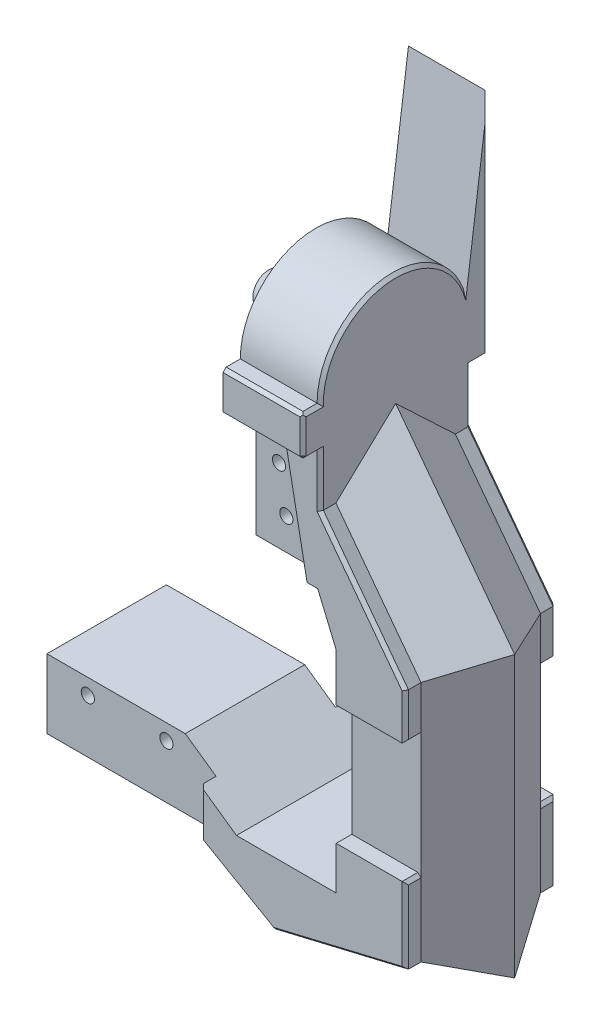
from build123d import *

# Parameters (mm, degrees)
SKETCH_1_R          = 2.1
EXTRUDE_1_DEPTH     = 38
CUT_EXTRUDE_1_DEPTH = 187.709206858
SKETCH_3_R          = 3
CUT_EXTRUDE_3_DEPTH = 1
EXTRUDE_2_DEPTH     = 5
EXTRUDE_3_DEPTH     = 5
EXTRUDE_2_2_DEPTH   = 25.432180104
EXTRUDE_7_DEPTH     = 25.432180104
SKETCH_18_W         = 25.432180104
SKETCH_18_H         = 5.5
EXTRUDE_8_DEPTH     = 2.30961622
EXTRUDE_10_DEPTH    = 5.5
SKETCH_21_R         = 5
SKETCH_20_R         = 13
CUT_EXTRUDE_4_REACH = 220.784
SKETCH_23_R         = 3
CHAMFER_1_SIZE      = 1


with BuildPart() as part:
    # 草图1 → 凸台-拉伸1 (new body)
    with BuildSketch(Plane.XY):
        Polygon((0, 0), (53.8, 0), (77, -13.394526245), (119, -3.414420564), (119, 73.585579436), (91.936542927, 109.5), (91.936542927, 158), (66.504362823, 158), (66.504362823, 88), (91.154362823, 88), (97, 74.085579436), (97, 7.085579436), (65.3, 7.085579436), (44, 22), (0, 22), align=None)
        with Locations((73.824362823, 111.53)):
            Circle(SKETCH_1_R, mode=Mode.SUBTRACT)
        with Locations((76.154362823, 98.03)):
            Circle(SKETCH_1_R, mode=Mode.SUBTRACT)
        with Locations((13, 17)):
            Circle(SKETCH_1_R, mode=Mode.SUBTRACT)
        with Locations((38, 17)):
            Circle(SKETCH_1_R, mode=Mode.SUBTRACT)
    extrude(amount=EXTRUDE_1_DEPTH)

    # 草图2 → 切除-拉伸1 (cut, through all)
    with BuildSketch(Plane(origin=(91.936542927, 0, 0), x_dir=(0, 0, -1), z_dir=(1, 0, 0))):
        with BuildLine():
            Line((-38, 158), (-38, 139))
            ThreePointArc((-38, 139), (-32.435028843, 152.435028843), (-19, 158))
            Line((-19, 158), (-38, 158))
        make_face()
        with BuildLine():
            Line((0, 158), (-19, 158))
            ThreePointArc((-19, 158), (-5.564971157, 152.435028843), (0, 139))
            Line((0, 139), (0, 158))
        make_face()
    extrude(amount=-CUT_EXTRUDE_1_DEPTH, mode=Mode.SUBTRACT)

    # 草图3 → 切除-拉伸3 (cut)
    with BuildSketch(Plane.ZY.offset(-66.504362823)):
        with Locations(Location((19, 139, 0), (0, 0, 270))):
            Circle(SKETCH_3_R)
    extrude(amount=-CUT_EXTRUDE_3_DEPTH, mode=Mode.SUBTRACT)

    # 扫描3: sweep along a path in 草图13
    with BuildLine(Plane.XY.offset(19)) as sweep_3_path:
        Line((91.936542927, 127.429097123), (129.79, 77.195862934))
        Line((129.79, 77.195862934), (129.79, -11.941020396))
        Line((129.79, -11.941020396), (77, -24.485062752))
    # 草图4 → 扫描3 (sweep)
    with BuildSketch(Plane.ZY.offset(-77)):
        Polygon((38, -13.394526245), (0, -13.394526245), (19, -24.485062752), align=None)
    sweep(path=sweep_3_path.line, transition=Transition.RIGHT)

    # 草图14 → Extrude 2 (add)
    with BuildSketch(Plane.XY.offset(38)):
        Polygon((66.504362823, 139), (66.504362823, 126.148557267), (80.434084519, 126.148557267), (87.742437222, 88), (91.154362823, 88), (97, 74.085579436), (97, 58.870893274), (118.999906629, 58.870893274), (118.999906629, 73.585548195), (91.936542927, 109.499844851), (91.936542927, 139), align=None)
        Polygon((118.999906629, 20.768869661), (97, 20.768869661), (97, 7.085579436), (65.3, 7.085579436), (53.8, 15.137966126), (53.8, 0), (77, -13.394526245), (118.999906629, -3.414439978), align=None)
    extrude(amount=EXTRUDE_2_DEPTH)

    # 草图15 → 凸台-拉伸3 (add)
    with BuildSketch(Plane(origin=(0, 0, 0), x_dir=(-1, 0, 0), z_dir=(0, 0, -1))):
        Polygon((-118.999906629, 73.585548195), (-118.999906629, 58.870893274), (-97, 58.870893274), (-97, 74.085579436), (-91.154362823, 88), (-87.742437222, 88), (-80.434084519, 126.148557267), (-66.504362823, 126.148557267), (-66.504362823, 139), (-91.936542927, 139), (-91.936542927, 109.499844851), align=None)
        Polygon((-77, -13.394526245), (-53.8, 0), (-53.8, 15.137966126), (-65.3, 7.085579436), (-97, 7.085579436), (-97, 20.768869661), (-118.999906629, 20.768869661), (-118.999906629, -3.414442751), align=None)
    extrude(amount=EXTRUDE_3_DEPTH)

    # 草图16 → Extrude 2 2 (add)
    with BuildSketch(Plane(origin=(91.936542927, 0, 0), x_dir=(0, 0, -1), z_dir=(1, 0, 0))):
        with BuildLine():
            ThreePointArc((-43, 139), (-19, 163), (5, 139))
            Line((5, 139), (-5, 139))
            ThreePointArc((-5, 139), (-19, 153), (-33, 139))
            Line((-33, 139), (-43, 139))
        make_face()
    extrude(amount=-EXTRUDE_2_2_DEPTH)

    # 草图17 → 凸台-拉伸7 (add)
    with BuildSketch(Plane(origin=(91.936542927, 0, 0), x_dir=(0, 0, -1), z_dir=(1, 0, 0))):
        with BuildLine():
            Line((5, 139), (5, 128.458173487))
            Line((5, 128.458173487), (10.5, 128.458173487))
            Line((10.5, 128.458173487), (10.5, 198.458173487))
            Line((10.5, 198.458173487), (3.602302269, 147.070683498))
            ThreePointArc((3.602302269, 147.070683498), (4.647994148, 143.095408742), (5, 139))
        make_face()
    extrude(amount=-EXTRUDE_7_DEPTH)

    # 草图18 → 凸台-拉伸8 (add)
    with BuildSketch(Plane.XZ.offset(-128.458173487)):
        with Locations((79.220452875, -7.75)):
            Rectangle(SKETCH_18_W, SKETCH_18_H)
    extrude(amount=EXTRUDE_8_DEPTH)

    # 草图19 → 凸台-拉伸10 (add)
    with BuildSketch(Plane.XY.offset(43)):
        Polygon((66.504362823, 126.148557267), (80.434084519, 126.148557267), (91.936542927, 126.148557267), (91.936542927, 139), (66.504362823, 139), align=None)
    extrude(amount=EXTRUDE_10_DEPTH)

    # 草图21 → 放样1 section 0
    with BuildSketch(Plane.ZY.offset(-51.504362823)):
        with Locations((19, 139)):
            Circle(SKETCH_21_R)
    # 草图20 → 放样1 section 1
    with BuildSketch(Plane.ZY.offset(-66.504362823)):
        with Locations((19, 139)):
            Circle(SKETCH_20_R)
    loft()

    # 草图23 → 切除-拉伸4 (cut, up to next)
    with BuildSketch(Plane.ZY.offset(-51.504362823), mode=Mode.PRIVATE) as cut_extrude_4_sk1:
        with Locations(Location((19, 139, 0), (0, 0, 270))):
            Circle(SKETCH_23_R)
    cut_extrude_4_tool1 = extrude(cut_extrude_4_sk1.sketch, amount=-CUT_EXTRUDE_4_REACH, mode=Mode.PRIVATE) & part.part
    add(cut_extrude_4_tool1.solids().sort_by_distance((51.504363, 139, 19))[0], mode=Mode.SUBTRACT)

    # 倒角1
    chamfer_1_edges = [part.edges().sort_by_distance(p)[0] for p in [
        (79.220452875, 139, 48.5),
    ]]
    chamfer(chamfer_1_edges, length=CHAMFER_1_SIZE)

    # 倒角3
    # the kernel refuses this chamfer: 1 mm, written as the material it takes off along each edge
    with BuildSketch(Plane(origin=(91.26987626, 126.815223933, 47.833333333), x_dir=(-0.7071067811865475, 0, 0.7071067811865475), z_dir=(0.5773502691896258, -0.5773502691896258, 0.5773502691896258))) as chamfer_3_piece_1:
        Polygon((-0.707106781, -0.40824829), (0.707106781, -0.40824829), (0, 0.816496581), align=None)
    extrude(amount=1.270170592, mode=Mode.SUBTRACT)
    with BuildSketch(Plane(origin=(53.8, 17.709649114, 43), x_dir=(0.9996219169112968, 0, 0.027495876610589005), z_dir=(0, -1, 0)), Plane(origin=(53.8, -2.571682988, -5), x_dir=(0.9996219169112968, 0, -0.027495876610586414), z_dir=(0, 1, 0))) as chamfer_3_piece_2:
        with BuildLine():
            Line((1.028673195, 0), (-0.056547155, -1.027117794))
            Line((-0.056547155, -1.027117794), (-0.076539593, -1.026567876))
            ThreePointArc((-0.076539593, -1.026567876), (-0.034129227, -0.51339783), (-0.019992438, 0.000549918))
            Line((-0.019992438, 0.000549918), (0.000549918, 0.019992438))
            ThreePointArc((0.000549918, 0.019992438), (0.514497665, 0.00585565), (1.029223113, 0.019992438))
            Line((1.029223113, 0.019992438), (1.028673195, 0))
        make_face()
    extrude(amount=20.281332101, mode=Mode.SUBTRACT)
    with BuildSketch(Plane(origin=(118.999906629, 20.768869661, 38), x_dir=(-0.9996219169112968, 0.02749587661058574, 0), z_dir=(0, 0, 1)), Plane(origin=(118.999906629, 58.870893274, 38), x_dir=(0.027495876610582105, 0.999621916911297, 0), z_dir=(0, 0, 1)), Plane(origin=(118.999906629, 58.870893274, 0), x_dir=(-0.9996219169112968, -0.027495876610589196, 0), z_dir=(0, 0, -1))) as chamfer_3_piece_3:
        with BuildLine():
            Line((1.028673195, 0), (-0.056547155, 1.027117794))
            Line((-0.056547155, 1.027117794), (-0.076539593, 1.026567876))
            ThreePointArc((-0.076539593, 1.026567876), (-0.034129227, 0.51339783), (-0.019992438, -0.000549918))
            Line((-0.019992438, -0.000549918), (0.000549918, -0.019992438))
            ThreePointArc((0.000549918, -0.019992438), (0.514497665, -0.00585565), (1.029223113, -0.019992438))
            Line((1.029223113, -0.019992438), (1.028673195, 0))
        make_face()
    extrude(amount=7.571682988, mode=Mode.SUBTRACT)
    with BuildSketch(Plane(origin=(51.572857202, 1.285841494, 43), x_dir=(0.4998109584556499, 0.8656979742248793, 0.027495876610589116), z_dir=(0.8660254037844378, -0.5000000000000017, 0)), Plane(origin=(79.227142798, -14.680367739, -5), x_dir=(0.49981095845565, 0.8656979742248795, -0.027495876610586535), z_dir=(-0.8660254037844378, 0.5000000000000017, 0))) as chamfer_3_piece_4:
        with BuildLine():
            Line((1.028673195, 0), (-0.056547155, -1.027117794))
            Line((-0.056547155, -1.027117794), (-0.076539593, -1.026567876))
            ThreePointArc((-0.076539593, -1.026567876), (-0.034129227, -0.51339783), (-0.019992438, 0.000549918))
            Line((-0.019992438, 0.000549918), (0.000549918, 0.019992438))
            ThreePointArc((0.000549918, 0.019992438), (0.514497665, 0.00585565), (1.029223113, 0.019992438))
            Line((1.029223113, 0.019992438), (1.028673195, 0))
        make_face()
    extrude(amount=31.932418466, mode=Mode.SUBTRACT)
    with BuildSketch(Plane(origin=(74.497984058, -13.989059351, 43), x_dir=(0.006356618994580412, -0.0267510116732474, -0.9996219169112968), z_dir=(0.9729099403562855, 0.23118444574825722, 0))) as chamfer_3_piece_5:
        with BuildLine():
            Line((1.028673195, 0), (-0.056547155, 1.027117794))
            Line((-0.056547155, 1.027117794), (-0.076539593, 1.026567876))
            ThreePointArc((-0.076539593, 1.026567876), (-0.034129227, 0.51339783), (-0.019992438, -0.000549918))
            Line((-0.019992438, -0.000549918), (0.000549918, -0.019992438))
            ThreePointArc((0.000549918, -0.019992438), (0.514497665, -0.00585565), (1.029223113, -0.019992438))
            Line((1.029223113, -0.019992438), (1.028673195, 0))
        make_face()
    extrude(amount=48.312733341, mode=Mode.SUBTRACT)
    with BuildSketch(Plane(origin=(118.999906629, -5.986122965, 43), x_dir=(0.027495876610582105, 0, -0.999621916911297), z_dir=(0, 1, 0))) as chamfer_3_piece_6:
        with BuildLine():
            Line((1.028673195, 0), (-0.056547155, 1.027117794))
            Line((-0.056547155, 1.027117794), (-0.076539593, 1.026567876))
            ThreePointArc((-0.076539593, 1.026567876), (-0.034129227, 0.51339783), (-0.019992438, -0.000549918))
            Line((-0.019992438, -0.000549918), (0.000549918, -0.019992438))
            ThreePointArc((0.000549918, -0.019992438), (0.514497665, -0.00585565), (1.029223113, -0.019992438))
            Line((1.029223113, -0.019992438), (1.028673195, 0))
        make_face()
    extrude(amount=29.326675615, mode=Mode.SUBTRACT)
    with BuildSketch(Plane(origin=(118.999906629, 56.299210286, 43), x_dir=(-0.9996219169112968, 0, 0.027495876610589196), z_dir=(0, 1, 0)), Plane(origin=(118.999906629, 76.157231183, -5), x_dir=(-0.9996219169112968, 0, -0.027495876610586605), z_dir=(0, -1, 0))) as chamfer_3_piece_7:
        with BuildLine():
            Line((1.028673195, 0), (-0.056547155, -1.027117794))
            Line((-0.056547155, -1.027117794), (-0.076539593, -1.026567876))
            ThreePointArc((-0.076539593, -1.026567876), (-0.034129227, -0.51339783), (-0.019992438, 0.000549918))
            Line((-0.019992438, 0.000549918), (0.000549918, 0.019992438))
            ThreePointArc((0.000549918, 0.019992438), (0.514497665, 0.00585565), (1.029223113, 0.019992438))
            Line((1.029223113, 0.019992438), (1.028673195, 0))
        make_face()
    extrude(amount=19.858020896, mode=Mode.SUBTRACT)
    with BuildSketch(Plane(origin=(120.547584086, 71.53171084, 43), x_dir=(-0.7983335594669047, -0.6015874870692686, 0.027495876610589096), z_dir=(-0.60181502315205, 0.7986355100472916, 0))) as chamfer_3_piece_8_section:
        with BuildLine():
            Line((1.028673195, 0), (-0.056547155, -1.027117794))
            Line((-0.056547155, -1.027117794), (-0.076539593, -1.026567876))
            ThreePointArc((-0.076539593, -1.026567876), (-0.034129227, -0.51339783), (-0.019992438, 0.000549918))
            Line((-0.019992438, 0.000549918), (0.000549918, 0.019992438))
            ThreePointArc((0.000549918, 0.019992438), (0.514497665, 0.00585565), (1.029223113, 0.019992438))
            Line((1.029223113, 0.019992438), (1.028673195, 0))
        make_face()
    chamfer_3_piece_8 = extrude(amount=50.112937457, mode=Mode.PRIVATE)
    chamfer_3_piece_8 = split(chamfer_3_piece_8, bisect_by=Plane(origin=(91.936542927, 90.144566019, 42.669249939), z_dir=(1, 0, 0)), keep=Keep.TOP, mode=Mode.PRIVATE)
    add(chamfer_3_piece_8, mode=Mode.SUBTRACT)
    with BuildSketch(Plane(origin=(91.936542927, 106.928161863, 43), x_dir=(0.027495876610582105, 0, -0.999621916911297), z_dir=(0, 1, 0))) as chamfer_3_piece_9_section:
        with BuildLine():
            Line((1.028673195, 0), (-0.056547155, 1.027117794))
            Line((-0.056547155, 1.027117794), (-0.076539593, 1.026567876))
            ThreePointArc((-0.076539593, 1.026567876), (-0.034129227, 0.51339783), (-0.019992438, -0.000549918))
            Line((-0.019992438, -0.000549918), (0.000549918, -0.019992438))
            ThreePointArc((0.000549918, -0.019992438), (0.514497665, -0.00585565), (1.029223113, -0.019992438))
            Line((1.029223113, -0.019992438), (1.028673195, 0))
        make_face()
    chamfer_3_piece_9 = extrude(amount=19.220395404, mode=Mode.PRIVATE)
    chamfer_3_piece_9 = split(chamfer_3_piece_9, bisect_by=Plane(origin=(87.71452173, 115.102656217, 42.667427315), z_dir=(0.7986355100472916, 0.60181502315205, 0)), keep=Keep.TOP, mode=Mode.PRIVATE)
    add(chamfer_3_piece_9, mode=Mode.SUBTRACT)
    with BuildSketch(Plane(origin=(90.38886547, 111.553682205, -5), x_dir=(-0.7983335594669051, -0.6015874870692681, -0.027495876610586504), z_dir=(0.6018150231520495, -0.7986355100472919, 0))) as chamfer_3_piece_10_section:
        with BuildLine():
            Line((1.028673195, 0), (-0.056547155, -1.027117794))
            Line((-0.056547155, -1.027117794), (-0.076539593, -1.026567876))
            ThreePointArc((-0.076539593, -1.026567876), (-0.034129227, -0.51339783), (-0.019992438, 0.000549918))
            Line((-0.019992438, 0.000549918), (0.000549918, 0.019992438))
            ThreePointArc((0.000549918, 0.019992438), (0.514497665, 0.00585565), (1.029223113, 0.019992438))
            Line((1.029223113, 0.019992438), (1.028673195, 0))
        make_face()
    chamfer_3_piece_10 = extrude(amount=50.112937457, mode=Mode.PRIVATE)
    chamfer_3_piece_10 = split(chamfer_3_piece_10, bisect_by=Plane(origin=(91.936542927, 90.144566019, -4.669249939), z_dir=(1, 0, 0)), keep=Keep.TOP, mode=Mode.PRIVATE)
    add(chamfer_3_piece_10, mode=Mode.SUBTRACT)
    with BuildSketch(Plane(origin=(118.999906629, 20.768869661, 0), x_dir=(-0.9996219169112968, 0.02749587661058574, 0), z_dir=(0, 0, -1))) as chamfer_3_piece_11:
        with BuildLine():
            Line((1.028673195, 0), (-0.056547155, -1.027117794))
            Line((-0.056547155, -1.027117794), (-0.076539593, -1.026567876))
            ThreePointArc((-0.076539593, -1.026567876), (-0.034129227, -0.51339783), (-0.019992438, 0.000549918))
            Line((-0.019992438, 0.000549918), (0.000549918, 0.019992438))
            ThreePointArc((0.000549918, 0.019992438), (0.514497665, 0.00585565), (1.029223113, 0.019992438))
            Line((1.029223113, 0.019992438), (1.028673195, 0))
        make_face()
    extrude(amount=7.571682988, mode=Mode.SUBTRACT)
    with BuildSketch(Plane(origin=(118.999906629, 23.340552649, -5), x_dir=(0.02749587661058217, 0, 0.9996219169112968), z_dir=(0, -1, 0))) as chamfer_3_piece_12:
        with BuildLine():
            Line((1.028673195, 0), (-0.056547155, 1.027117794))
            Line((-0.056547155, 1.027117794), (-0.076539593, 1.026567876))
            ThreePointArc((-0.076539593, 1.026567876), (-0.034129227, 0.51339783), (-0.019992438, -0.000549918))
            Line((-0.019992438, -0.000549918), (0.000549918, -0.019992438))
            ThreePointArc((0.000549918, -0.019992438), (0.514497665, -0.00585565), (1.029223113, -0.019992438))
            Line((1.029223113, -0.019992438), (1.028673195, 0))
        make_face()
    extrude(amount=29.326678388, mode=Mode.SUBTRACT)
    with BuildSketch(Plane(origin=(121.501922608, -2.819909801, -5), x_dir=(-0.2310969780314448, 0.9725421140054292, -0.027495876610586514), z_dir=(-0.9729099548061726, -0.231184384937762, 0))) as chamfer_3_piece_13:
        with BuildLine():
            Line((1.028673195, 0), (-0.056547155, -1.027117794))
            Line((-0.056547155, -1.027117794), (-0.076539593, -1.026567876))
            ThreePointArc((-0.076539593, -1.026567876), (-0.034129227, -0.51339783), (-0.019992438, 0.000549918))
            Line((-0.019992438, 0.000549918), (0.000549918, 0.019992438))
            ThreePointArc((0.000549918, 0.019992438), (0.514497665, 0.00585565), (1.029223113, 0.019992438))
            Line((1.029223113, 0.019992438), (1.028673195, 0))
        make_face()
    extrude(amount=48.3127327, mode=Mode.SUBTRACT)
    with BuildSketch(Plane(origin=(91.936542927, 139, 19), x_dir=(0, 0, 1), z_dir=(0, -1, 0))) as chamfer_3_piece_14_section:
        with BuildLine():
            Line((22.971715729, -0.028284271), (24.028284271, 1.028284271))
            Line((24.028284271, 1.028284271), (24.048284271, 1.028284271))
            ThreePointArc((24.048284271, 1.028284271), (24.02, 0.514142136), (24.02, 0))
            Line((24.02, 0), (24, -0.02))
            ThreePointArc((24, -0.02), (23.485857864, -0.02), (22.971715729, -0.048284271))
            Line((22.971715729, -0.048284271), (22.971715729, -0.028284271))
        make_face()
    chamfer_3_piece_14 = revolve(axis=Axis((91.936542927, 139, 19), (-1, 0, 0)), revolution_arc=166.496974045, mode=Mode.PRIVATE)
    chamfer_3_piece_14 = split(chamfer_3_piece_14, bisect_by=Plane(origin=(91.460066415, 158.711193826, -5.164797766), z_dir=(0, 0.13303598850024104, 0.9911112075664182)), keep=Keep.TOP, mode=Mode.PRIVATE)
    add(chamfer_3_piece_14, mode=Mode.SUBTRACT)
    with BuildSketch(Plane(origin=(91.936542927, 123.576874279, -10.5), x_dir=(0.0274958766105822, 0, 0.999621916911297), z_dir=(0, 1, 0))) as chamfer_3_piece_15:
        with BuildLine():
            Line((1.028673195, 0), (-0.056547155, -1.027117794))
            Line((-0.056547155, -1.027117794), (-0.076539593, -1.026567876))
            ThreePointArc((-0.076539593, -1.026567876), (-0.034129227, -0.51339783), (-0.019992438, 0.000549918))
            Line((-0.019992438, 0.000549918), (0.000549918, 0.019992438))
            ThreePointArc((0.000549918, 0.019992438), (0.514497665, 0.00585565), (1.029223113, 0.019992438))
            Line((1.029223113, 0.019992438), (1.028673195, 0))
        make_face()
    extrude(amount=77.452982196, mode=Mode.SUBTRACT)
    with BuildSketch(Plane(origin=(91.936542927, 126.148557267, -5), x_dir=(0.02749587661058217, 0, 0.9996219169112968), z_dir=(0, -1, 0))) as chamfer_3_piece_16_section:
        with BuildLine():
            Line((1.028673195, 0), (-0.056547155, 1.027117794))
            Line((-0.056547155, 1.027117794), (-0.076539593, 1.026567876))
            ThreePointArc((-0.076539593, 1.026567876), (-0.034129227, 0.51339783), (-0.019992438, -0.000549918))
            Line((-0.019992438, -0.000549918), (0.000549918, -0.019992438))
            ThreePointArc((0.000549918, -0.019992438), (0.514497665, -0.00585565), (1.029223113, -0.019992438))
            Line((1.029223113, -0.019992438), (1.028673195, 0))
        make_face()
    chamfer_3_piece_16 = extrude(amount=19.220395404, mode=Mode.PRIVATE)
    chamfer_3_piece_16 = split(chamfer_3_piece_16, bisect_by=Plane(origin=(87.71452173, 115.102656217, -4.667427315), z_dir=(0.7986355100472919, 0.6018150231520495, 0)), keep=Keep.TOP, mode=Mode.PRIVATE)
    add(chamfer_3_piece_16, mode=Mode.SUBTRACT)
    with BuildSketch(Plane(origin=(91.936542927, 126.148557267, -13.071682988), x_dir=(0.02749587661058229, 0.9996219169112968, 0), z_dir=(0, 0, 1)), Plane(origin=(91.936542927, 126.148557267, 43), x_dir=(0.02749587661058229, 0.9996219169112968, 0), z_dir=(0, 0, 1))) as chamfer_3_piece_17:
        with BuildLine():
            Line((1.028673195, 0), (-0.056547155, 1.027117794))
            Line((-0.056547155, 1.027117794), (-0.076539593, 1.026567876))
            ThreePointArc((-0.076539593, 1.026567876), (-0.034129227, 0.51339783), (-0.019992438, -0.000549918))
            Line((-0.019992438, -0.000549918), (0.000549918, -0.019992438))
            ThreePointArc((0.000549918, -0.019992438), (0.514497665, -0.00585565), (1.029223113, -0.019992438))
            Line((1.029223113, -0.019992438), (1.028673195, 0))
        make_face()
    extrude(amount=8.071682988, mode=Mode.SUBTRACT)
    with BuildSketch(Plane(origin=(94.508225915, 126.148557267, 48.5), x_dir=(0, 0.9996219169112968, 0.027495876610589196), z_dir=(-1, 0, 0))) as chamfer_3_piece_18:
        with BuildLine():
            Line((1.028673195, 0), (-0.056547155, 1.027117794))
            Line((-0.056547155, 1.027117794), (-0.076539593, 1.026567876))
            ThreePointArc((-0.076539593, 1.026567876), (-0.034129227, 0.51339783), (-0.019992438, -0.000549918))
            Line((-0.019992438, -0.000549918), (0.000549918, -0.019992438))
            ThreePointArc((0.000549918, -0.019992438), (0.514497665, -0.00585565), (1.029223113, -0.019992438))
            Line((1.029223113, -0.019992438), (1.028673195, 0))
        make_face()
    extrude(amount=30.575546079, mode=Mode.SUBTRACT)
    with BuildSketch(Plane(origin=(91.936542927, 123.576874279, 48.5), x_dir=(0.027495876610582105, 0, -0.999621916911297), z_dir=(0, 1, 0))) as chamfer_3_piece_19:
        with BuildLine():
            Line((1.028673195, 0), (-0.056547155, 1.027117794))
            Line((-0.056547155, 1.027117794), (-0.076539593, 1.026567876))
            ThreePointArc((-0.076539593, 1.026567876), (-0.034129227, 0.51339783), (-0.019992438, -0.000549918))
            Line((-0.019992438, -0.000549918), (0.000549918, -0.019992438))
            ThreePointArc((0.000549918, -0.019992438), (0.514497665, -0.00585565), (1.029223113, -0.019992438))
            Line((1.029223113, -0.019992438), (1.028673195, 0))
        make_face()
    extrude(amount=16.994808709, mode=Mode.SUBTRACT)
    with BuildSketch(Plane(origin=(91.936542927, 139, 40.428317012), x_dir=(-0.999621916911297, 0.027495876610582292, 0), z_dir=(0, 0, 1))) as chamfer_3_piece_20_section:
        with BuildLine():
            Line((1.028673195, 0), (-0.056547155, 1.027117794))
            Line((-0.056547155, 1.027117794), (-0.076539593, 1.026567876))
            ThreePointArc((-0.076539593, 1.026567876), (-0.034129227, 0.51339783), (-0.019992438, -0.000549918))
            Line((-0.019992438, -0.000549918), (0.000549918, -0.019992438))
            ThreePointArc((0.000549918, -0.019992438), (0.514497665, -0.00585565), (1.029223113, -0.019992438))
            Line((1.029223113, -0.019992438), (1.028673195, 0))
        make_face()
    chamfer_3_piece_20 = extrude(amount=9.643365976, mode=Mode.PRIVATE)
    chamfer_3_piece_20 = chamfer_3_piece_20 - Plane(origin=(91.606828487, 139, 19), x_dir=(0, 0, 1), z_dir=(1, 0, 0)) * Cylinder(24, 24, mode=Mode.PRIVATE)
    add(chamfer_3_piece_20, mode=Mode.SUBTRACT)
    with BuildSketch(Plane(origin=(91.936542927, 106.928161863, 43), x_dir=(0.027495876610582105, 0, -0.999621916911297), z_dir=(0, 1, 0))) as chamfer_3_piece_21a_section:
        with BuildLine():
            Line((1.028673195, 0), (-0.056547155, 1.027117794))
            Line((-0.056547155, 1.027117794), (-0.076539593, 1.026567876))
            ThreePointArc((-0.076539593, 1.026567876), (-0.034129227, 0.51339783), (-0.019992438, -0.000549918))
            Line((-0.019992438, -0.000549918), (0.000549918, -0.019992438))
            ThreePointArc((0.000549918, -0.019992438), (0.514497665, -0.00585565), (1.029223113, -0.019992438))
            Line((1.029223113, -0.019992438), (1.028673195, 0))
        make_face()
    chamfer_3_piece_21a = extrude(amount=19.220395404, mode=Mode.PRIVATE)
    chamfer_3_piece_21a = split(chamfer_3_piece_21a, bisect_by=Plane(origin=(92.310865996, 109.003101361, 42.685176958), z_dir=(-0.7986355100472916, -0.60181502315205, 0)), keep=Keep.TOP, mode=Mode.PRIVATE)
    with BuildSketch(Plane(origin=(120.547584086, 71.53171084, 43), x_dir=(-0.7983335594669047, -0.6015874870692686, 0.027495876610589096), z_dir=(-0.60181502315205, 0.7986355100472916, 0))) as chamfer_3_piece_21b_section:
        with BuildLine():
            Line((1.028673195, 0), (-0.056547155, -1.027117794))
            Line((-0.056547155, -1.027117794), (-0.076539593, -1.026567876))
            ThreePointArc((-0.076539593, -1.026567876), (-0.034129227, -0.51339783), (-0.019992438, 0.000549918))
            Line((-0.019992438, 0.000549918), (0.000549918, 0.019992438))
            ThreePointArc((0.000549918, 0.019992438), (0.514497665, 0.00585565), (1.029223113, 0.019992438))
            Line((1.029223113, 0.019992438), (1.028673195, 0))
        make_face()
    chamfer_3_piece_21b = extrude(amount=50.112937457, mode=Mode.PRIVATE)
    chamfer_3_piece_21b = split(chamfer_3_piece_21b, bisect_by=Plane(origin=(91.936542927, 110.121835087, 42.685176958), z_dir=(-1, 0, 0)), keep=Keep.TOP, mode=Mode.PRIVATE)
    chamfer_3_piece_21 = chamfer_3_piece_21a & chamfer_3_piece_21b
    add(chamfer_3_piece_21, mode=Mode.SUBTRACT)
    with BuildSketch(Plane(origin=(91.936542927, 126.148557267, 40.428317012), x_dir=(0.02749587661058229, 0.9996219169112968, 0), z_dir=(0, 0, 1))) as chamfer_3_piece_22a_section:
        with BuildLine():
            Line((1.028673195, 0), (-0.056547155, 1.027117794))
            Line((-0.056547155, 1.027117794), (-0.076539593, 1.026567876))
            ThreePointArc((-0.076539593, 1.026567876), (-0.034129227, 0.51339783), (-0.019992438, -0.000549918))
            Line((-0.019992438, -0.000549918), (0.000549918, -0.019992438))
            ThreePointArc((0.000549918, -0.019992438), (0.514497665, -0.00585565), (1.029223113, -0.019992438))
            Line((1.029223113, -0.019992438), (1.028673195, 0))
        make_face()
    chamfer_3_piece_22a = extrude(amount=10.643365976, mode=Mode.PRIVATE)
    chamfer_3_piece_22a = split(chamfer_3_piece_22a, bisect_by=Plane(origin=(91.6067493, 126.478350894, 43), z_dir=(0, 0, -1)), keep=Keep.TOP, mode=Mode.PRIVATE)
    with BuildSketch(Plane(origin=(91.936542927, 106.928161863, 43), x_dir=(0.027495876610582105, 0, -0.999621916911297), z_dir=(0, 1, 0))) as chamfer_3_piece_22b_section:
        with BuildLine():
            Line((1.028673195, 0), (-0.056547155, 1.027117794))
            Line((-0.056547155, 1.027117794), (-0.076539593, 1.026567876))
            ThreePointArc((-0.076539593, 1.026567876), (-0.034129227, 0.51339783), (-0.019992438, -0.000549918))
            Line((-0.019992438, -0.000549918), (0.000549918, -0.019992438))
            ThreePointArc((0.000549918, -0.019992438), (0.514497665, -0.00585565), (1.029223113, -0.019992438))
            Line((1.029223113, -0.019992438), (1.028673195, 0))
        make_face()
    chamfer_3_piece_22b = extrude(amount=21.792078392, mode=Mode.PRIVATE)
    chamfer_3_piece_22b = split(chamfer_3_piece_22b, bisect_by=Plane(origin=(91.6067493, 126.148557267, 42.670206373), z_dir=(0, 1, 0)), keep=Keep.TOP, mode=Mode.PRIVATE)
    chamfer_3_piece_22 = chamfer_3_piece_22a & chamfer_3_piece_22b
    add(chamfer_3_piece_22, mode=Mode.SUBTRACT)
    with BuildSketch(Plane(origin=(91.936542927, 126.148557267, -5), x_dir=(0.02749587661058217, 0, 0.9996219169112968), z_dir=(0, -1, 0))) as chamfer_3_piece_23a_section:
        with BuildLine():
            Line((1.028673195, 0), (-0.056547155, 1.027117794))
            Line((-0.056547155, 1.027117794), (-0.076539593, 1.026567876))
            ThreePointArc((-0.076539593, 1.026567876), (-0.034129227, 0.51339783), (-0.019992438, -0.000549918))
            Line((-0.019992438, -0.000549918), (0.000549918, -0.019992438))
            ThreePointArc((0.000549918, -0.019992438), (0.514497665, -0.00585565), (1.029223113, -0.019992438))
            Line((1.029223113, -0.019992438), (1.028673195, 0))
        make_face()
    chamfer_3_piece_23a = extrude(amount=19.220395404, mode=Mode.PRIVATE)
    chamfer_3_piece_23a = split(chamfer_3_piece_23a, bisect_by=Plane(origin=(92.310865996, 109.003101361, -4.685176958), z_dir=(-0.7986355100472919, -0.6018150231520495, 0)), keep=Keep.TOP, mode=Mode.PRIVATE)
    with BuildSketch(Plane(origin=(90.38886547, 111.553682205, -5), x_dir=(-0.7983335594669051, -0.6015874870692681, -0.027495876610586504), z_dir=(0.6018150231520495, -0.7986355100472919, 0))) as chamfer_3_piece_23b_section:
        with BuildLine():
            Line((1.028673195, 0), (-0.056547155, -1.027117794))
            Line((-0.056547155, -1.027117794), (-0.076539593, -1.026567876))
            ThreePointArc((-0.076539593, -1.026567876), (-0.034129227, -0.51339783), (-0.019992438, 0.000549918))
            Line((-0.019992438, 0.000549918), (0.000549918, 0.019992438))
            ThreePointArc((0.000549918, 0.019992438), (0.514497665, 0.00585565), (1.029223113, 0.019992438))
            Line((1.029223113, 0.019992438), (1.028673195, 0))
        make_face()
    chamfer_3_piece_23b = extrude(amount=50.112937457, mode=Mode.PRIVATE)
    chamfer_3_piece_23b = split(chamfer_3_piece_23b, bisect_by=Plane(origin=(91.936542927, 110.121835087, -4.685176958), z_dir=(-1, 0, 0)), keep=Keep.TOP, mode=Mode.PRIVATE)
    chamfer_3_piece_23 = chamfer_3_piece_23a & chamfer_3_piece_23b
    add(chamfer_3_piece_23, mode=Mode.SUBTRACT)
    with BuildSketch(Plane(origin=(91.936542927, 139, 40.428317012), x_dir=(-0.999621916911297, 0.027495876610582292, 0), z_dir=(0, 0, 1))) as chamfer_3_piece_24a_section:
        with BuildLine():
            Line((1.028673195, 0), (-0.056547155, 1.027117794))
            Line((-0.056547155, 1.027117794), (-0.076539593, 1.026567876))
            ThreePointArc((-0.076539593, 1.026567876), (-0.034129227, 0.51339783), (-0.019992438, -0.000549918))
            Line((-0.019992438, -0.000549918), (0.000549918, -0.019992438))
            ThreePointArc((0.000549918, -0.019992438), (0.514497665, -0.00585565), (1.029223113, -0.019992438))
            Line((1.029223113, -0.019992438), (1.028673195, 0))
        make_face()
    chamfer_3_piece_24a = extrude(amount=9.643365976, mode=Mode.PRIVATE)
    chamfer_3_piece_24a = chamfer_3_piece_24a & Plane(origin=(91.606531136, 139, 19), x_dir=(0, 0, 1), z_dir=(1, 0, 0)) * Cylinder(24, 24, mode=Mode.PRIVATE)
    with BuildSketch(Plane(origin=(91.936542927, 139, 19), x_dir=(0, -0.10708445732496112, 0.9942499278347565), z_dir=(0, -0.9942499278347565, -0.10708445732496112))) as chamfer_3_piece_24b_section:
        with BuildLine():
            Line((22.971715729, -0.028284271), (24.028284271, 1.028284271))
            Line((24.028284271, 1.028284271), (24.048284271, 1.028284271))
            ThreePointArc((24.048284271, 1.028284271), (24.02, 0.514142136), (24.02, 0))
            Line((24.02, 0), (24, -0.02))
            ThreePointArc((24, -0.02), (23.485857864, -0.02), (22.971715729, -0.048284271))
            Line((22.971715729, -0.048284271), (22.971715729, -0.028284271))
        make_face()
    chamfer_3_piece_24b = revolve(axis=Axis((91.936542927, 139, 19), (-1, 0, 0)), revolution_arc=172.644248448, mode=Mode.PRIVATE)
    chamfer_3_piece_24b = split(chamfer_3_piece_24b, bisect_by=Plane(origin=(91.605315127, 139, 42.627498031), z_dir=(0, -1, 0)), keep=Keep.TOP, mode=Mode.PRIVATE)
    chamfer_3_piece_24 = chamfer_3_piece_24a & chamfer_3_piece_24b
    add(chamfer_3_piece_24, mode=Mode.SUBTRACT)
    with BuildSketch(Plane(origin=(91.936542927, 126.148557267, -13.071682988), x_dir=(0.02749587661058229, 0.9996219169112968, 0), z_dir=(0, 0, 1))) as chamfer_3_piece_25a_section:
        with BuildLine():
            Line((1.028673195, 0), (-0.056547155, 1.027117794))
            Line((-0.056547155, 1.027117794), (-0.076539593, 1.026567876))
            ThreePointArc((-0.076539593, 1.026567876), (-0.034129227, 0.51339783), (-0.019992438, -0.000549918))
            Line((-0.019992438, -0.000549918), (0.000549918, -0.019992438))
            ThreePointArc((0.000549918, -0.019992438), (0.514497665, -0.00585565), (1.029223113, -0.019992438))
            Line((1.029223113, -0.019992438), (1.028673195, 0))
        make_face()
    chamfer_3_piece_25a = extrude(amount=10.643365976, mode=Mode.PRIVATE)
    chamfer_3_piece_25a = split(chamfer_3_piece_25a, bisect_by=Plane(origin=(91.6067493, 126.478350893, -5), z_dir=(0, 0, 1)), keep=Keep.TOP, mode=Mode.PRIVATE)
    with BuildSketch(Plane(origin=(91.936542927, 128.720240255, -5), x_dir=(0.02749587661058217, 0, 0.9996219169112968), z_dir=(0, -1, 0))) as chamfer_3_piece_25b_section:
        with BuildLine():
            Line((1.028673195, 0), (-0.056547155, 1.027117794))
            Line((-0.056547155, 1.027117794), (-0.076539593, 1.026567876))
            ThreePointArc((-0.076539593, 1.026567876), (-0.034129227, 0.51339783), (-0.019992438, -0.000549918))
            Line((-0.019992438, -0.000549918), (0.000549918, -0.019992438))
            ThreePointArc((0.000549918, -0.019992438), (0.514497665, -0.00585565), (1.029223113, -0.019992438))
            Line((1.029223113, -0.019992438), (1.028673195, 0))
        make_face()
    chamfer_3_piece_25b = extrude(amount=21.792078392, mode=Mode.PRIVATE)
    chamfer_3_piece_25b = split(chamfer_3_piece_25b, bisect_by=Plane(origin=(91.6067493, 126.148557267, -4.670206373), z_dir=(0, 1, 0)), keep=Keep.TOP, mode=Mode.PRIVATE)
    chamfer_3_piece_25 = chamfer_3_piece_25a & chamfer_3_piece_25b
    add(chamfer_3_piece_25, mode=Mode.SUBTRACT)


solid = part.part
